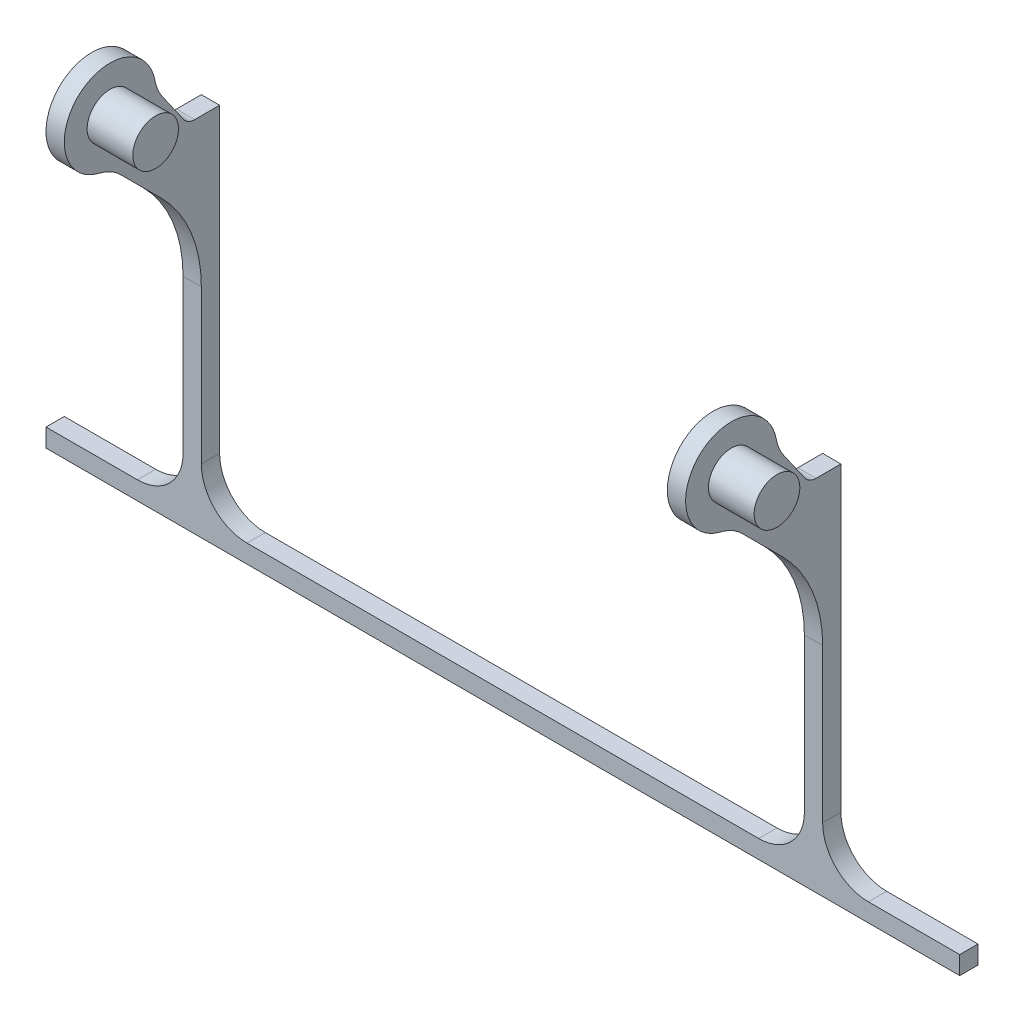
from build123d import *

# Parameters (mm, degrees)
BOSS_EXTRU_1_DEPTH = 4
BOSS_EXTRU_2_DEPTH = 4
BOSS_EXTRU_3_START = -4
BOSS_EXTRU_3_DEPTH = 4
CONG_1_R           = 30
CONG_2_R           = 30
CONG_3_R           = 10
BOSS_EXTRU_4_DEPTH = 4
BOSS_EXTRU_5_DEPTH = 4
ESQUISSE7_R        = 5
BOSS_EXTRU_6_DEPTH = 10
ESQUISSE9_R        = 5
BOSS_EXTRU_7_DEPTH = 14
CONG_4_R           = 10
CONG_5_R           = 3


with BuildPart() as part:
    # Esquisse1 → Boss.-Extru.1 (new body)
    with BuildSketch(Plane.XY):
        Polygon((-70, -110), (-66, -110), (-66, -176), (66, -176), (66, -110), (70, -110), (70, -176), (100, -176), (100, -180), (-100, -180), (-100, -176), (-70, -176), align=None)
    extrude(amount=-BOSS_EXTRU_1_DEPTH)

    # Esquisse2 → Boss.-Extru.2 (add)
    with BuildSketch(Plane(origin=(70, 0, 0), x_dir=(0, 0, -1), z_dir=(1, 0, 0))):
        with BuildLine():
            Line((0, -120), (-20, -100))
            ThreePointArc((-20, -100), (-27.071067812, -82.928932188), (-10, -90))
            Line((-10, -90), (4, -110))
            Line((4, -110), (0, -110))
            Line((0, -110), (0, -120))
        make_face()
    extrude(amount=-BOSS_EXTRU_2_DEPTH)

    # Esquisse3 → Boss.-Extru.3 (add)
    with BuildSketch(Plane.ZY.offset(70).offset(BOSS_EXTRU_3_START)):
        with BuildLine():
            Line((-4, -110), (10, -90))
            ThreePointArc((10, -90), (27.071067812, -82.928932188), (20, -100))
            Line((20, -100), (0, -120))
            Line((0, -120), (0, -110))
            Line((0, -110), (-4, -110))
        make_face()
    extrude(amount=BOSS_EXTRU_3_DEPTH)

    # Congé1
    cong_1_edges = [part.edges().sort_by_distance(p)[0] for p in [
        (68, -120, 0),
        (-68, -120, 0),
    ]]
    fillet(cong_1_edges, radius=CONG_1_R)

    # Congé2
    cong_2_edges = [part.edges().sort_by_distance(p)[0] for p in [
        (-68, -110, -4),
        (68, -110, -4),
    ]]
    fillet(cong_2_edges, radius=CONG_2_R)

    # Congé3
    cong_3_edges = [part.edges().sort_by_distance(p)[0] for p in [
        (66, -176, -2),
        (-66, -176, -2),
        (-70, -176, -2),
        (70, -176, -2),
    ]]
    fillet(cong_3_edges, radius=CONG_3_R)

    # Esquisse4 → Boss.-Extru.4 (add)
    with BuildSketch(Plane.ZY.offset(70)):
        Polygon((-4, -119.456666925), (-4, -100), (3, -100), align=None)
    extrude(amount=-BOSS_EXTRU_4_DEPTH)

    # Esquisse6 → Boss.-Extru.5 (add)
    with BuildSketch(Plane(origin=(70, 0, 0), x_dir=(0, 0, -1), z_dir=(1, 0, 0))):
        Polygon((4, -119.456666925), (4, -100), (-3, -100), align=None)
    extrude(amount=-BOSS_EXTRU_5_DEPTH)

    # Esquisse7 → Boss.-Extru.6 (add)
    with BuildSketch(Plane(origin=(70, 0, 0), x_dir=(0, 0, -1), z_dir=(1, 0, 0))):
        with Locations((-20, -90)):
            Circle(ESQUISSE7_R)
    extrude(amount=BOSS_EXTRU_6_DEPTH)

    # Esquisse9 → Boss.-Extru.7 (add)
    with BuildSketch(Plane.ZY.offset(70)):
        with Locations((20, -90)):
            Circle(ESQUISSE9_R)
    extrude(amount=-BOSS_EXTRU_7_DEPTH)

    # Congé4
    cong_4_edges = [part.edges().sort_by_distance(p)[0] for p in [
        (-68, -100, 20),
        (-68, -90, 10),
        (68, -90, 10),
        (68, -100, 20),
    ]]
    fillet(cong_4_edges, radius=CONG_4_R)

    # Congé5
    cong_5_edges = [part.edges().sort_by_distance(p)[0] for p in [
        (-68, -100, 3),
        (68, -100, 3),
    ]]
    fillet(cong_5_edges, radius=CONG_5_R)


solid = part.part
